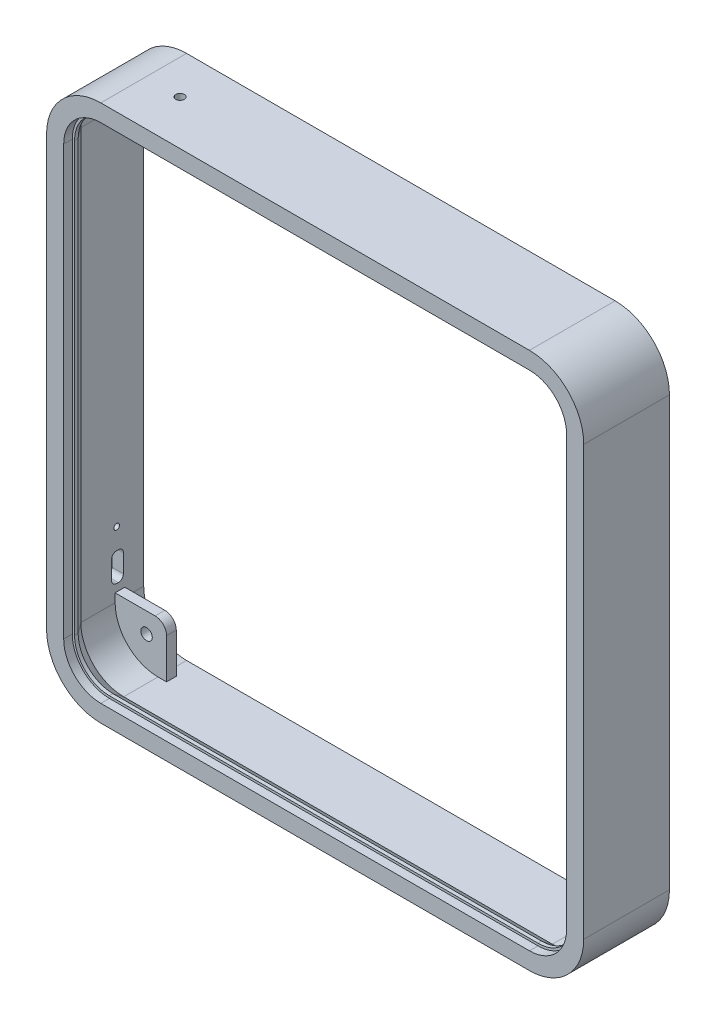
from build123d import *

# Parameters (mm, degrees)
SKETCH2_W                                 = 188
SKETCH2_H                                 = 188
BOSS_EXTRUDE1_DEPTH                       = 30
FILLET1_R                                 = 19
CUT_EXTRUDE6_DEPTH                        = 4
CUT_EXTRUDE8_SVUOTAMENTO_DEPTH            = 26
CUT_EXTRUDE9_ALLOGGIAMENTO_FINESTRA_DEPTH = 3
BOSS_EXTRUDE2_DEPTH                       = 10
FILLET4_R                                 = 4
F_4_0MM_DOWEL_HOLE2_D                     = 4
CUT_EXTRUDE10_DEPTH                       = 6.6
CUT_EXTRUDE4_REACH                        = 217.044
SKETCH11_R                                = 1.5
CUT_EXTRUDE5_REACH                        = 217.044
SKETCH15_R                                = 1
CHAMFER1_SIZE                             = 4
CHAMFER1_SIZE_2                           = 3


with BuildPart() as part:
    # Sketch2 → Boss-Extrude1 (new body)
    with BuildSketch(Plane.XY):
        with Locations((-6, 6)):
            Rectangle(SKETCH2_W, SKETCH2_H)
    extrude(amount=BOSS_EXTRUDE1_DEPTH)

    # Fillet1
    fillet1_edges = [part.edges().sort_by_distance(p)[0] for p in [
        (88, -88, 15),
        (-100, -88, 15),
        (-100, 100, 15),
        (88, 100, 15),
    ]]
    fillet(fillet1_edges, radius=FILLET1_R)

    # Sketch18 → Cut-Extrude6 (cut)
    with BuildSketch(Plane.XY.offset(30)):
        with BuildLine():
            Line((-93.2, 81), (-93.2, -69))
            ThreePointArc((-93.2, -69), (-89.62670273, -77.62670273), (-81, -81.2))
            Line((-81, -81.2), (69, -81.2))
            ThreePointArc((69, -81.2), (77.62670273, -77.62670273), (81.2, -69))
            Line((81.2, -69), (81.2, 81))
            ThreePointArc((81.2, 81), (77.62670273, 89.62670273), (69, 93.2))
            Line((69, 93.2), (-81, 93.2))
            ThreePointArc((-81, 93.2), (-89.62670273, 89.62670273), (-93.2, 81))
        make_face()
    extrude(amount=-CUT_EXTRUDE6_DEPTH, mode=Mode.SUBTRACT)

    # Sketch19 → Cut-Extrude8-svuotamento (cut)
    with BuildSketch(Plane(origin=(0, 0, 0), x_dir=(-1, 0, 0), z_dir=(0, 0, -1))):
        with BuildLine():
            Line((-69, -84), (81, -84))
            ThreePointArc((81, -84), (91.606601718, -79.606601718), (96, -69))
            Line((96, -69), (96, 81))
            ThreePointArc((96, 81), (91.606601718, 91.606601718), (81, 96))
            Line((81, 96), (-69, 96))
            ThreePointArc((-69, 96), (-79.606601718, 91.606601718), (-84, 81))
            Line((-84, 81), (-84, -69))
            ThreePointArc((-84, -69), (-79.606601718, -79.606601718), (-69, -84))
        make_face()
    extrude(amount=-CUT_EXTRUDE8_SVUOTAMENTO_DEPTH, mode=Mode.SUBTRACT)

    # Sketch20 → Cut-Extrude9-alloggiamento-finestra (cut)
    with BuildSketch(Plane.XY.offset(30)):
        with BuildLine():
            Line((-94, 81), (-94, -69))
            ThreePointArc((-94, -69), (-90.192388155, -78.192388155), (-81, -82))
            Line((-81, -82), (69, -82))
            ThreePointArc((69, -82), (78.192388155, -78.192388155), (82, -69))
            Line((82, -69), (82, 81))
            ThreePointArc((82, 81), (78.192388155, 90.192388155), (69, 94))
            Line((69, 94), (-81, 94))
            ThreePointArc((-81, 94), (-90.192388155, 90.192388155), (-94, 81))
        make_face()
    extrude(amount=-CUT_EXTRUDE9_ALLOGGIAMENTO_FINESTRA_DEPTH, mode=Mode.SUBTRACT)

    # Sketch22 → Boss-Extrude2 (add)
    with BuildSketch(Plane(origin=(0, 0, 0), x_dir=(-1, 0, 0), z_dir=(0, 0, -1))):
        with BuildLine():
            Line((-84, 78), (-66, 78))
            Line((-66, 78), (-66, 96))
            Line((-66, 96), (-69, 96))
            ThreePointArc((-69, 96), (-79.606601718, 91.606601718), (-84, 81))
            Line((-84, 81), (-84, 78))
        make_face()
        with BuildLine():
            Line((81, 96), (78, 96))
            Line((78, 96), (78, 78))
            Line((78, 78), (96, 78))
            Line((96, 78), (96, 81))
            ThreePointArc((96, 81), (91.606601718, 91.606601718), (81, 96))
        make_face()
        with BuildLine():
            Line((78, -66), (78, -84))
            Line((78, -84), (81, -84))
            ThreePointArc((81, -84), (91.606601718, -79.606601718), (96, -69))
            Line((96, -69), (96, -66))
            Line((96, -66), (78, -66))
        make_face()
        with BuildLine():
            Line((-66, -66), (-84, -66))
            Line((-84, -66), (-84, -69))
            ThreePointArc((-84, -69), (-79.606601718, -79.606601718), (-69, -84))
            Line((-69, -84), (-66, -84))
            Line((-66, -84), (-66, -66))
        make_face()
    extrude(amount=-BOSS_EXTRUDE2_DEPTH)

    # Fillet4
    fillet4_edges = [part.edges().sort_by_distance(p)[0] for p in [
        (66, 78, 5),
        (-78, 78, 5),
        (-78, -66, 5),
        (66, -66, 5),
    ]]
    fillet(fillet4_edges, radius=FILLET4_R)

    # Ø4.0mm Dowel Hole2 (through all)
    with Locations(Plane(origin=(0, 0, 0), x_dir=(-1, 0, 0), z_dir=(0, 0, -1))):
        with Locations((-73, 85), (85, 85), (85, -73), (-73, -73)):
            Hole(F_4_0MM_DOWEL_HOLE2_D / 2)

    # Sketch30 → Cut-Extrude10 (cut)
    with BuildSketch(Plane(origin=(0, 0, 0), x_dir=(-1, 0, 0), z_dir=(0, 0, -1))):
        with BuildLine():
            Line((-69, -84), (81, -84))
            ThreePointArc((81, -84), (91.606601718, -79.606601718), (96, -69))
            Line((96, -69), (96, 81))
            ThreePointArc((96, 81), (91.606601718, 91.606601718), (81, 96))
            Line((81, 96), (-69, 96))
            ThreePointArc((-69, 96), (-79.606601718, 91.606601718), (-84, 81))
            Line((-84, 81), (-84, -69))
            ThreePointArc((-84, -69), (-79.606601718, -79.606601718), (-69, -84))
        make_face()
    extrude(amount=-CUT_EXTRUDE10_DEPTH, mode=Mode.SUBTRACT)

    # Sketch11 → Cut-Extrude4 (cut, up to next)
    with BuildSketch(Plane(origin=(0, 100, 0), x_dir=(1, 0, 0), z_dir=(0, 1, 0)), mode=Mode.PRIVATE) as cut_extrude4_sk1:
        with Locations(Location((-68.95500318, -14.324851484, 0), (0, 0, 270))):
            Circle(SKETCH11_R)
    cut_extrude4_tool1 = extrude(cut_extrude4_sk1.sketch, amount=-CUT_EXTRUDE4_REACH, mode=Mode.PRIVATE) & part.part
    add(cut_extrude4_tool1.solids().sort_by_distance((-68.955003, 100, 14.324851))[0], mode=Mode.SUBTRACT)

    # Sketch15 → Cut-Extrude5 (cut, up to next)
    with BuildSketch(Plane(origin=(-100, 0, 0), x_dir=(0, 0, -1), z_dir=(1, 0, 0)), mode=Mode.PRIVATE) as cut_extrude5_sk1:
        with Locations(Location((-9.460245724, -46.22788492, 0), (0, 0, 180))):
            Circle(SKETCH15_R)
    cut_extrude5_tool1 = extrude(cut_extrude5_sk1.sketch, amount=CUT_EXTRUDE5_REACH, mode=Mode.PRIVATE) & part.part
    # Sketch15 → Cut-Extrude5 (cut, up to next)
    with BuildSketch(Plane(origin=(-100, 0, 0), x_dir=(0, 0, -1), z_dir=(1, 0, 0)), mode=Mode.PRIVATE) as cut_extrude5_sk2:
        with BuildLine():
            Line((-8.900245724, -53.495303579), (-9.460245724, -53.495303579))
            ThreePointArc((-9.460245724, -53.495303579), (-10.73303793, -54.022511373), (-11.260245724, -55.295303579))
            Line((-11.260245724, -55.295303579), (-11.260245724, -61.645303576))
            ThreePointArc((-11.260245724, -61.645303576), (-10.73303793, -62.918095782), (-9.460245724, -63.445303576))
            Line((-9.460245724, -63.445303576), (-8.900245724, -63.445303576))
            ThreePointArc((-8.900245724, -63.445303576), (-7.627453518, -62.918095782), (-7.100245724, -61.645303576))
            Line((-7.100245724, -61.645303576), (-7.100245724, -55.295303579))
            ThreePointArc((-7.100245724, -55.295303579), (-7.627453518, -54.022511373), (-8.900245724, -53.495303579))
        make_face()
    cut_extrude5_tool2 = extrude(cut_extrude5_sk2.sketch, amount=CUT_EXTRUDE5_REACH, mode=Mode.PRIVATE) & part.part
    add(cut_extrude5_tool1.solids().sort_by_distance((-100, -46.227885, 9.460246))[0], mode=Mode.SUBTRACT)
    add(cut_extrude5_tool2.solids().sort_by_distance((-100, -58.470304, 9.180246))[0], mode=Mode.SUBTRACT)

    # Chamfer1
    # the kernel refuses this chamfer: 4, 3 mm, written as the material it adds along each edge
    with BuildSketch(Plane(origin=(69, -84, 26), x_dir=(0, -0.023249527748764737, -0.9997296931968459), z_dir=(-1, 0, 0))) as chamfer1_piece_1_section:
        Polygon((CHAMFER1_SIZE * 0.999729693197, -CHAMFER1_SIZE * 0.0232495277488), (-CHAMFER1_SIZE_2 * 0.0232495277488, -CHAMFER1_SIZE_2 * 0.999729693197), (0, 0), align=None)
    chamfer1_piece_1 = extrude(amount=150, mode=Mode.PRIVATE)
    chamfer1_piece_1 = split(chamfer1_piece_1, bisect_by=Plane(origin=(-6, -81.2, 24.654371932), z_dir=(0, -1, 0)), keep=Keep.TOP, mode=Mode.PRIVATE)
    add(chamfer1_piece_1)
    with BuildSketch(Plane(origin=(-81, -69, 26), x_dir=(0, -1, 0), z_dir=(1, 0, 0))) as chamfer1_piece_2_section:
        Polygon((15 - CHAMFER1_SIZE_2, 0), (15, CHAMFER1_SIZE), (15, 0), align=None)
    chamfer1_piece_2 = revolve(axis=Axis((-81, -69, 26), (0, 0, -1)), revolution_arc=90, mode=Mode.PRIVATE)
    chamfer1_piece_2 = chamfer1_piece_2 - Plane(origin=(-81, -69, 24.826857266), x_dir=(-1, 0, 0), z_dir=(0, 0, 1)) * Cylinder(12.2, 60, mode=Mode.PRIVATE)
    add(chamfer1_piece_2)
    with BuildSketch(Plane(origin=(69, -69, 26), x_dir=(1, 0, 0), z_dir=(0, 1, 0))) as chamfer1_piece_3_section:
        Polygon((15 - CHAMFER1_SIZE_2, 0), (15, CHAMFER1_SIZE), (15, 0), align=None)
    chamfer1_piece_3 = revolve(axis=Axis((69, -69, 26), (0, 0, -1)), revolution_arc=90, mode=Mode.PRIVATE)
    chamfer1_piece_3 = chamfer1_piece_3 - Plane(origin=(69, -69, 24.826857266), x_dir=(0, -1, 0), z_dir=(0, 0, 1)) * Cylinder(12.2, 60, mode=Mode.PRIVATE)
    add(chamfer1_piece_3)
    with BuildSketch(Plane(origin=(-96, -69, 26), x_dir=(-0.023249527748764737, 0, -0.9997296931968459), z_dir=(0, 1, 0))) as chamfer1_piece_4_section:
        Polygon((CHAMFER1_SIZE * 0.999729693197, -CHAMFER1_SIZE * 0.0232495277488), (-CHAMFER1_SIZE_2 * 0.0232495277488, -CHAMFER1_SIZE_2 * 0.999729693197), (0, 0), align=None)
    chamfer1_piece_4 = extrude(amount=150, mode=Mode.PRIVATE)
    chamfer1_piece_4 = split(chamfer1_piece_4, bisect_by=Plane(origin=(-93.2, 6, 24.654371932), z_dir=(-1, 0, 0)), keep=Keep.TOP, mode=Mode.PRIVATE)
    add(chamfer1_piece_4)
    with BuildSketch(Plane(origin=(84, 81, 26), x_dir=(0.023249527748764737, 0, -0.9997296931968459), z_dir=(0, -1, 0))) as chamfer1_piece_5_section:
        Polygon((CHAMFER1_SIZE * 0.999729693197, -CHAMFER1_SIZE * 0.0232495277488), (-CHAMFER1_SIZE_2 * 0.0232495277488, -CHAMFER1_SIZE_2 * 0.999729693197), (0, 0), align=None)
    chamfer1_piece_5 = extrude(amount=150, mode=Mode.PRIVATE)
    chamfer1_piece_5 = split(chamfer1_piece_5, bisect_by=Plane(origin=(81.2, 6, 24.654371932), z_dir=(1, 0, 0)), keep=Keep.TOP, mode=Mode.PRIVATE)
    add(chamfer1_piece_5)
    with BuildSketch(Plane(origin=(-81, 81, 26), x_dir=(-1, 0, 0), z_dir=(0, -1, 0))) as chamfer1_piece_6_section:
        Polygon((15 - CHAMFER1_SIZE_2, 0), (15, CHAMFER1_SIZE), (15, 0), align=None)
    chamfer1_piece_6 = revolve(axis=Axis((-81, 81, 26), (0, 0, -1)), revolution_arc=90, mode=Mode.PRIVATE)
    chamfer1_piece_6 = chamfer1_piece_6 - Plane(origin=(-81, 81, 24.826857266), x_dir=(0, 1, 0), z_dir=(0, 0, 1)) * Cylinder(12.2, 61, mode=Mode.PRIVATE)
    add(chamfer1_piece_6)
    with BuildSketch(Plane(origin=(69, 81, 26), x_dir=(0, 1, 0), z_dir=(-1, 0, 0))) as chamfer1_piece_7_section:
        Polygon((15, CHAMFER1_SIZE), (15 - CHAMFER1_SIZE_2, 0), (15, 0), align=None)
    chamfer1_piece_7 = revolve(axis=Axis((69, 81, 26), (0, 0, -1)), revolution_arc=90, mode=Mode.PRIVATE)
    chamfer1_piece_7 = chamfer1_piece_7 - Plane(origin=(69, 81, 24.516674107), x_dir=(1, 0, 0), z_dir=(0, 0, 1)) * Cylinder(12.2, 61, mode=Mode.PRIVATE)
    add(chamfer1_piece_7)
    with BuildSketch(Plane(origin=(-81, 96, 26), x_dir=(0, 0.023249527748764737, -0.9997296931968459), z_dir=(1, 0, 0))) as chamfer1_piece_8_section:
        Polygon((CHAMFER1_SIZE * 0.999729693197, -CHAMFER1_SIZE * 0.0232495277488), (-CHAMFER1_SIZE_2 * 0.0232495277488, -CHAMFER1_SIZE_2 * 0.999729693197), (0, 0), align=None)
    chamfer1_piece_8 = extrude(amount=150, mode=Mode.PRIVATE)
    chamfer1_piece_8 = split(chamfer1_piece_8, bisect_by=Plane(origin=(-6, 93.2, 24.654371932), z_dir=(0, 1, 0)), keep=Keep.TOP, mode=Mode.PRIVATE)
    add(chamfer1_piece_8)


solid = part.part
